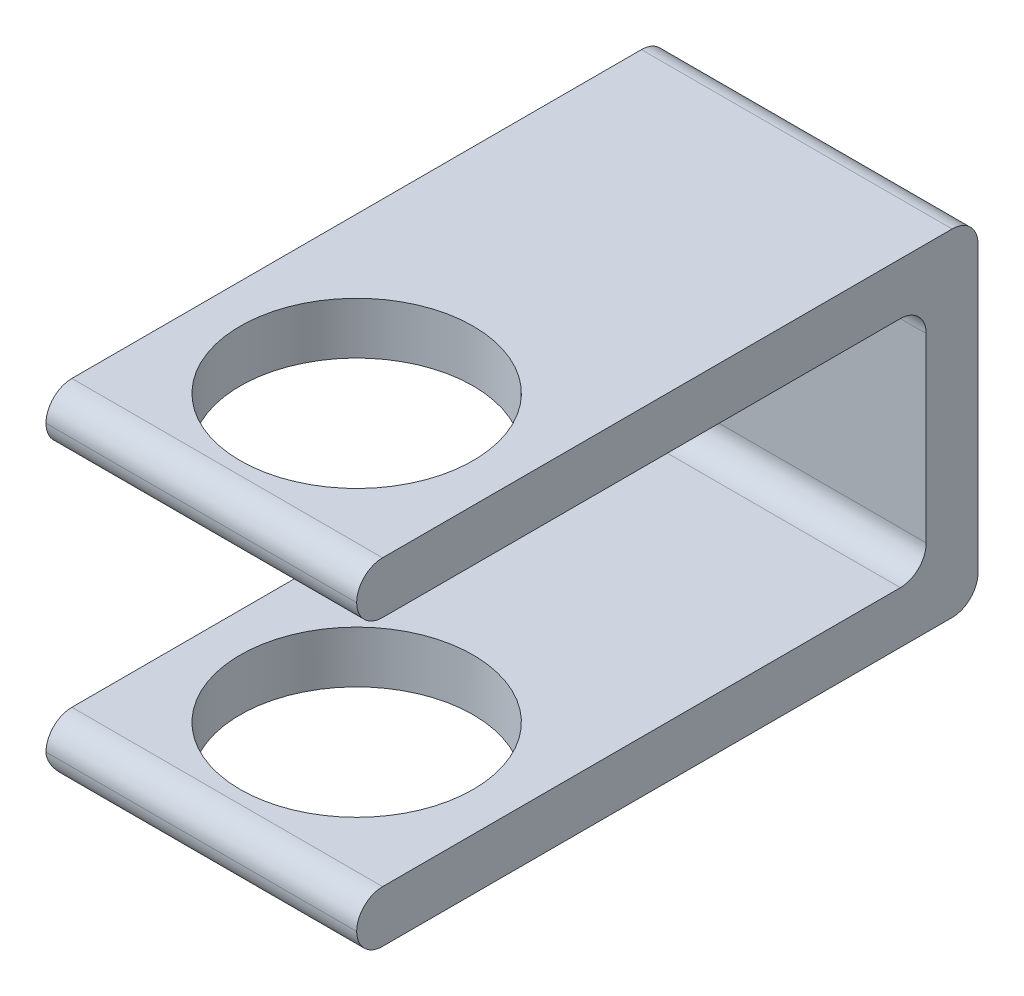
from build123d import *

# Parameters (mm, degrees)
SKETCH1_W           = 38.1
SKETCH1_H           = 76.2
BOSS_EXTRUDE1_DEPTH = 41.275
SKETCH2_W           = 38.1
SKETCH2_H           = 28.575
CUT_EXTRUDE1_DEPTH  = 69.85
SKETCH3_R           = 14.2875
CUT_EXTRUDE2_DEPTH  = 60.313894873
FILLET1_R           = 3.175


with BuildPart() as part:
    # Sketch1 → Boss-Extrude1 (new body)
    with BuildSketch(Plane(origin=(0, 0, 0), x_dir=(1, 0, 0), z_dir=(0, 1, 0))):
        Rectangle(SKETCH1_W, SKETCH1_H)
    extrude(amount=BOSS_EXTRUDE1_DEPTH)

    # Sketch2 → Cut-Extrude1 (cut)
    with BuildSketch(Plane.XY.offset(38.1)):
        with Locations((0, 20.6375)):
            Rectangle(SKETCH2_W, SKETCH2_H)
    extrude(amount=-CUT_EXTRUDE1_DEPTH, mode=Mode.SUBTRACT)

    # Sketch3 → Cut-Extrude2 (cut, through all)
    # profile 1 of 2: a face of its own
    with BuildSketch(Plane(origin=(0, 41.275, 0), x_dir=(1, 0, 0), z_dir=(0, 1, 0))):
        with Locations(Location((0, -19.05, 0), (0, 0, 270))):
            Circle(SKETCH3_R)
        Polygon((7.332348419, -19.05), (3.666174209, -12.7), (-3.666174209, -12.7), (-7.332348419, -19.05), (-3.666174209, -25.4), (3.666174209, -25.4), align=None, mode=Mode.SUBTRACT)
    # profile 2 of 2: a face of its own
    with BuildSketch(Plane(origin=(0, 41.275, 0), x_dir=(1, 0, 0), z_dir=(0, 1, 0))):
        Polygon((3.666174209, -25.4), (7.332348419, -19.05), (3.666174209, -12.7), (-3.666174209, -12.7), (-7.332348419, -19.05), (-3.666174209, -25.4), align=None)
    extrude(amount=-CUT_EXTRUDE2_DEPTH, mode=Mode.SUBTRACT)

    # Fillet1
    fillet1_edges = [part.edges().sort_by_distance(p)[0] for p in [
        (0, 41.275, 38.1),
        (0, 0, -38.1),
        (0, 0, 38.1),
        (0, 6.35, 38.1),
        (0, 6.35, -31.75),
        (0, 34.925, -31.75),
        (0, 34.925, 38.1),
        (0, 41.275, -38.1),
        (-19.05, 0, 0),
    ]]
    fillet(fillet1_edges, radius=FILLET1_R - 0.0001)  # a hair under: the kernel refuses the full size


solid = part.part
